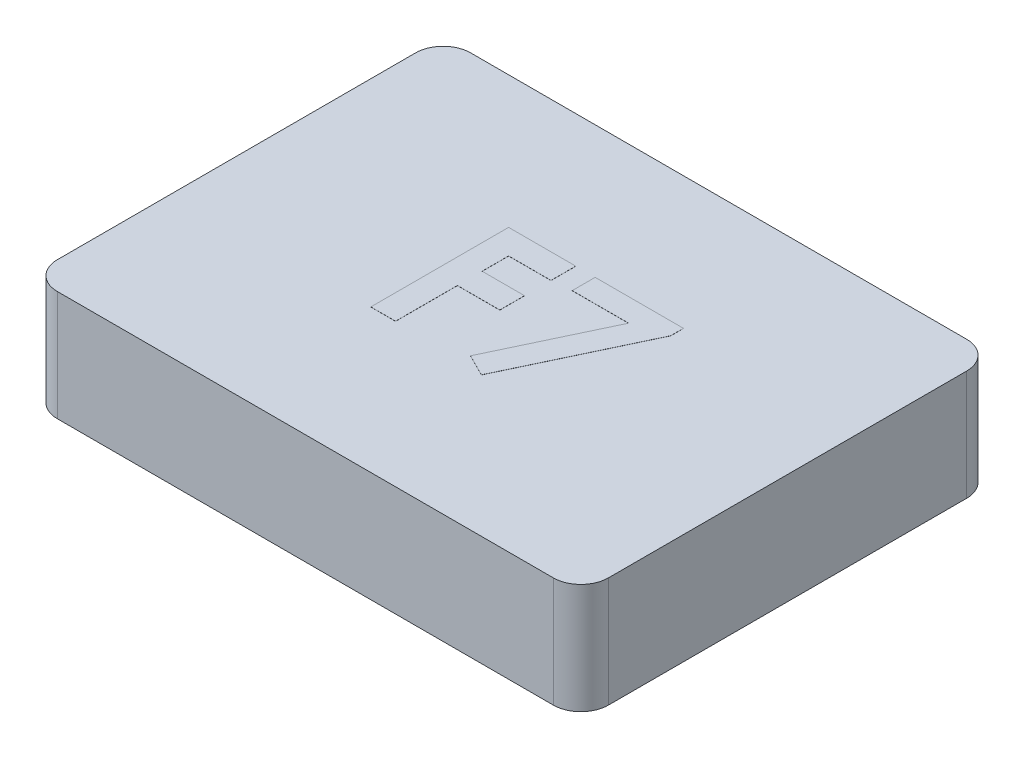
from build123d import *

# Parameters (mm, degrees)
SKETCH1_W           = 12.7
SKETCH1_H           = 9.525
BOSS_EXTRUDE1_DEPTH = 2.54
FILLET1_R           = 0.635
SHELL1_START        = 0.635
SHELL1_OUTLINE_W    = 1.905
SHELL1_OUTLINE_H    = 8.255
SHELL1_DEPTH        = 11.43
SKETCH2_R           = 2.54
BOSS_EXTRUDE2_DEPTH = 1.905
BOSS_EXTRUDE3_DEPTH = 0.00254


# Read off the part's stored shape, not the designer's step: Shell1
with BuildPart() as part:
    # Sketch1 → Boss-Extrude1 (new body)
    with BuildSketch(Plane(origin=(0, 0, 0), x_dir=(1, 0, 0), z_dir=(0, 1, 0))):
        with Locations((6.35, 4.7625)):
            Rectangle(SKETCH1_W, SKETCH1_H)
    extrude(amount=BOSS_EXTRUDE1_DEPTH)

    # Fillet1
    fillet1_edges = [part.edges().sort_by_distance(p)[0] for p in [
        (0, 1.27, -9.525),
        (12.7, 1.27, -9.525),
        (12.7, 1.27, 0),
        (0, 1.27, 0),
    ]]
    fillet(fillet1_edges, radius=FILLET1_R)

    # Shell1 outline → Shell1 (cut)
    with BuildSketch(Plane.YZ.offset(SHELL1_START)):
        with Locations((0.9525, -4.7625)):
            Rectangle(SHELL1_OUTLINE_W, SHELL1_OUTLINE_H)
    extrude(amount=SHELL1_DEPTH, mode=Mode.SUBTRACT)

    # Sketch2 → Boss-Extrude2 (add)
    with BuildSketch(Plane(origin=(0, 1.905, 0), x_dir=(-1, 0, 0), z_dir=(0, -1, 0))):
        with Locations(Location((-6.35, 4.7625, 0), (0, 0, 270))):
            Circle(SKETCH2_R)
    extrude(amount=BOSS_EXTRUDE2_DEPTH)

    # Sketch3 → Boss-Extrude3 (add)
    with BuildSketch(Plane(origin=(0, 2.54, 0), x_dir=(1, 0, 0), z_dir=(0, 1, 0))):
        Polygon((4.557346154, 6.477), (6.104141026, 6.477), (6.104141026, 5.907128205), (5.127217949, 5.907128205), (5.127217949, 5.296551282), (6.104141026, 5.296551282), (6.104141026, 4.726679487), (5.127217949, 4.726679487), (5.127217949, 3.302), (4.557346154, 3.302), align=None)
        Polygon((6.551897436, 6.477), (8.587153846, 6.477), (8.587153846, 6.181251803), (7.186643029, 3.220589744), (6.681645032, 3.474996795), (7.851917468, 5.947833333), (6.551897436, 5.947833333), align=None)
    extrude(amount=BOSS_EXTRUDE3_DEPTH)


solid = part.part
